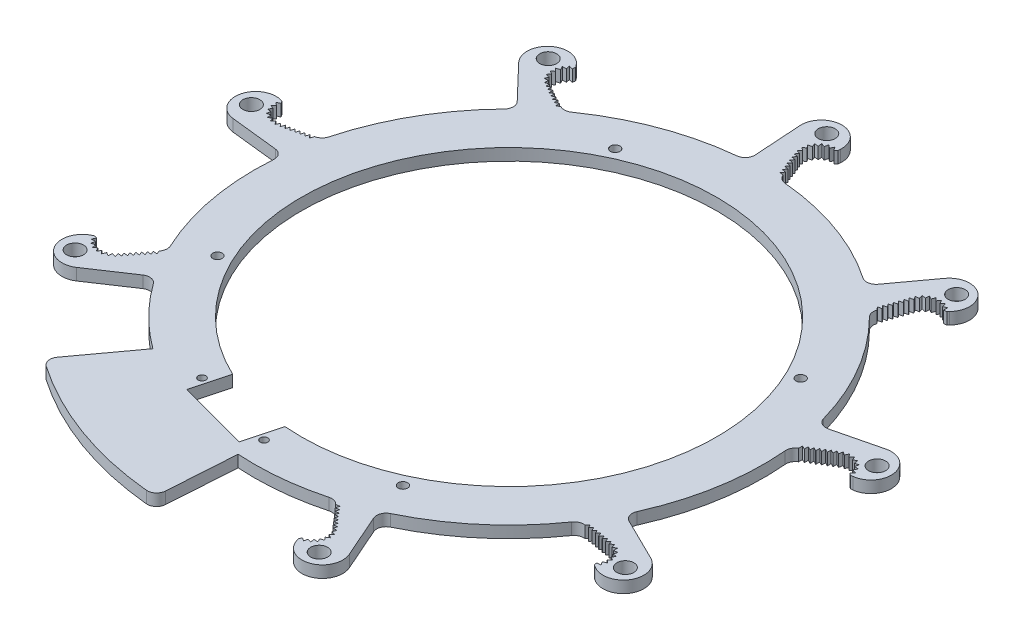
from build123d import *

# Parameters (mm, degrees)
SKETCH1_R           = 68.58
SKETCH1_R_2         = 55.88
BOSS_EXTRUDE1_DEPTH = 3.175
BOSS_EXTRUDE2_START = -3.175
BOSS_EXTRUDE2_DEPTH = 3.175
CIRPATTERN1_COUNT   = 9
SKETCH4_R           = 1.27
CUT_EXTRUDE1_DEPTH  = 126.801087163
CIRPATTERN14_COUNT  = 4
CUT_EXTRUDE3_DEPTH  = 126.801087163
CRVPATTERN1_DEPTH   = 3.175
CIRPATTERN15_COUNT  = 9
SKETCH3_R           = 2.286
CUT_EXTRUDE6_DEPTH  = 126.801087163
CIRPATTERN16_COUNT  = 9
BOSS_EXTRUDE3_START = -3.175
BOSS_EXTRUDE3_DEPTH = 3.175
SKETCH10_R          = 1.016
CUT_EXTRUDE7_DEPTH  = 126.801087163


# Read off the part's stored shape, not the designer's step: CrvPattern1
with BuildPart() as part:
    # Sketch1 → Boss-Extrude1 (new body)
    with BuildSketch(Plane(origin=(0, 0, 0), x_dir=(1, 0, 0), z_dir=(0, 1, 0))):
        with Locations(Location((0, 0, 0), (0, 0, 270))):
            Circle(SKETCH1_R)
        with Locations(Location((0, 0, 0), (0, 0, 270))):
            Circle(SKETCH1_R_2, mode=Mode.SUBTRACT)
    extrude(amount=BOSS_EXTRUDE1_DEPTH)

    # Sketch2 → Boss-Extrude2 (add)
    with BuildSketch(Plane(origin=(0, 3.175, 0), x_dir=(1, 0, 0), z_dir=(0, 1, 0)).offset(BOSS_EXTRUDE2_START)):
        with BuildLine():
            Line((-4.648503105, 70.922452149), (-5.403257241, 82.437775015))
            Line((-5.403257241, 82.437775015), (-5.486319215, 83.705055847))
            ThreePointArc((-5.486319215, 83.705055847), (0, 89.562739257), (5.486319215, 83.705055847))
            Line((5.486319215, 83.705055847), (5.403257241, 82.437775015))
            ThreePointArc((5.403257241, 82.437775015), (1.626784434, 81.258873226), (0.932471896, 77.364070743))
            Line((0.932471896, 77.364070743), (3.81, 69.933821868))
            ThreePointArc((3.81, 69.933821868), (4.653269667, 68.820093806), (5.957919454, 68.320711324))
            ThreePointArc((5.957919454, 68.320711324), (-0.486454802, 68.578274707), (-6.926526743, 68.22931648))
            ThreePointArc((-6.926526743, 68.22931648), (-5.243785443, 69.115963701), (-4.648503105, 70.922452149))
        make_face()
    boss_extrude2 = extrude(amount=BOSS_EXTRUDE2_DEPTH)

    # CirPattern1: Boss-Extrude2 ×9 about axis
    cirpattern1_axis = Axis((0, 0, 0), (0, 1, 0))
    for i in range(1, CIRPATTERN1_COUNT):
        add(boss_extrude2.rotate(cirpattern1_axis, i * 360 / CIRPATTERN1_COUNT))

    # Sketch4 → Cut-Extrude1 (cut, through all)
    with BuildSketch(Plane(origin=(0, 3.175, 0), x_dir=(1, 0, 0), z_dir=(0, 1, 0))):
        with Locations(Location((53.522006363, 24.957721447, 0), (0, 0, 270))):
            Circle(SKETCH4_R)
    cut_extrude1 = extrude(amount=-CUT_EXTRUDE1_DEPTH, mode=Mode.SUBTRACT)

    # CirPattern14: Cut-Extrude1 ×4 about axis
    cirpattern14_axis = Axis((0, 0, 0), (0, 1, 0))
    for i in range(1, CIRPATTERN14_COUNT):
        add(cut_extrude1.rotate(cirpattern14_axis, i * 360 / CIRPATTERN14_COUNT), mode=Mode.SUBTRACT)

    # Sketch8 → Cut-Extrude3 (cut, through all)
    with BuildSketch(Plane(origin=(0, 3.175, 0), x_dir=(1, 0, 0), z_dir=(0, 1, 0))):
        Polygon((3.498451264, 71.089959522), (3.95709435, 69.905667953), (2.780339552, 70.130899269), align=None)
    cut_extrude3 = extrude(amount=-CUT_EXTRUDE3_DEPTH, mode=Mode.SUBTRACT)

    # CrvPattern1 outline → CrvPattern1 (cut)
    with BuildSketch(Plane(origin=(0, 0, 0), x_dir=(1, 0, 0), z_dir=(0, 1, 0))):
        with BuildLine():
            Line((0.965870842, 77.246670917), (0.345476312, 76.418114962))
            Line((0.345476312, 76.418114962), (1.37513676, 76.22103756))
            Line((1.37513676, 76.22103756), (0.932471896, 77.364070743))
            ThreePointArc((0.932471896, 77.364070743), (1.626784434, 81.258873226), (5.403257241, 82.437775015))
            Line((5.403257241, 82.437775015), (5.449136611, 83.137758941))
            Line((5.449136611, 83.137758941), (4.852674168, 82.560680789))
            Line((4.852674168, 82.560680789), (4.242889668, 83.432740738))
            Line((4.242889668, 83.432740738), (3.726224495, 82.50248121))
            Line((3.726224495, 82.50248121), (2.88928111, 83.159635273))
            Line((2.88928111, 83.159635273), (2.665331301, 82.119360225))
            Line((2.665331301, 82.119360225), (1.673506022, 82.504857707))
            Line((1.673506022, 82.504857707), (1.761611498, 81.444403504))
            Line((1.761611498, 81.444403504), (0.700556651, 81.524953505))
            Line((0.700556651, 81.524953505), (1.093108774, 80.535899147))
            Line((1.093108774, 80.535899147), (0.05445523, 80.304545508))
            Line((0.05445523, 80.304545508), (0.717553875, 79.472304029))
            Line((0.717553875, 79.472304029), (-0.209002033, 78.949026052))
            Line((-0.209002033, 78.949026052), (0.667379075, 78.345468395))
            Line((0.667379075, 78.345468395), (-0.067063422, 77.575455466))
            Line((-0.067063422, 77.575455466), (0.965870842, 77.246670917))
        make_face()
        Polygon((3.40418946, 70.98169115), (3.00287676, 72.017946273), (2.374529012, 71.178768551), align=None)
        Polygon((2.99837892, 72.029560432), (2.59706622, 73.065815555), (1.968718472, 72.226637833), align=None)
        Polygon((2.59256838, 73.077429714), (2.19125568, 74.113684837), (1.562907932, 73.274507115), align=None)
        Polygon((2.18675784, 74.125298996), (1.78544514, 75.161554119), (1.157097392, 74.322376397), align=None)
        Polygon((1.7809473, 75.173168278), (1.3796346, 76.209423401), (0.751286852, 75.37024568), align=None)
    crvpattern1 = extrude(amount=CRVPATTERN1_DEPTH, mode=Mode.SUBTRACT)

    # CirPattern15: Cut-Extrude3, CrvPattern1 ×9 about axis, 1 skipped
    cirpattern15_axis = Axis((0, 0, 0), (0, -1, 0))
    add([cut_extrude3.rotate(cirpattern15_axis, i * 360 / CIRPATTERN15_COUNT) for i in range(1, CIRPATTERN15_COUNT) if i not in (5,)], mode=Mode.SUBTRACT)
    add([crvpattern1.rotate(cirpattern15_axis, i * 360 / CIRPATTERN15_COUNT) for i in range(1, CIRPATTERN15_COUNT) if i not in (5,)], mode=Mode.SUBTRACT)

    # Sketch3 → Cut-Extrude6 (cut, through all)
    with BuildSketch(Plane(origin=(0, 3.175, 0), x_dir=(1, 0, 0), z_dir=(0, 1, 0))):
        with Locations(Location((0, 85.498739257, 0), (0, 0, 270))):
            Circle(SKETCH3_R)
    cut_extrude6 = extrude(amount=-CUT_EXTRUDE6_DEPTH, mode=Mode.SUBTRACT)

    # CirPattern16: Cut-Extrude6 ×9 about axis, 1 skipped
    cirpattern16_axis = Axis((0, 0, 0), (0, -1, 0))
    add([cut_extrude6.rotate(cirpattern16_axis, i * 360 / CIRPATTERN16_COUNT) for i in range(1, CIRPATTERN16_COUNT) if i not in (5,)], mode=Mode.SUBTRACT)

    # Sketch9 → Boss-Extrude3 (add)
    with BuildSketch(Plane(origin=(0, 3.175, 0), x_dir=(1, 0, 0), z_dir=(0, 1, 0)).offset(BOSS_EXTRUDE3_START)):
        with BuildLine():
            ThreePointArc((-23.473361516, -80.533454986), (-26.266415504, -83.899198551), (-30.632261018, -84.161445141))
            ThreePointArc((-30.632261018, -84.161445141), (-19.707239561, -87.367665484), (-8.463727598, -89.161928974))
            ThreePointArc((-8.463727598, -89.161928974), (-6.577008759, -88.567209197), (-5.689134551, -86.799419905))
            Line((-5.689134551, -86.799419905), (-4.485346603, -68.433164956))
            ThreePointArc((-4.485346603, -68.433164956), (-10.700662367, -67.740034137), (-16.826994534, -66.483596887))
            ThreePointArc((-16.826994534, -66.483596887), (-18.711505325, -66.741241317), (-19.888743183, -68.235186631))
            Line((-19.888743183, -68.235186631), (-23.473361516, -80.533454986))
        make_face()
        with BuildLine():
            Line((-40.552015685, -55.305970961), (-51.435461734, -70.149118483))
            ThreePointArc((-51.435461734, -70.149118483), (-51.891623684, -72.074038187), (-50.828591706, -73.74237946))
            ThreePointArc((-50.828591706, -73.74237946), (-41.062231601, -79.595084014), (-30.632261018, -84.161445141))
            ThreePointArc((-30.632261018, -84.161445141), (-33.808123696, -81.154241171), (-33.78426888, -76.780591618))
            Line((-33.78426888, -76.780591618), (-33.272780584, -75.618146039))
            ThreePointArc((-33.272780584, -75.618146039), (-29.320848796, -75.801970499), (-27.336307524, -72.379522219))
            Line((-27.336307524, -72.379522219), (-27.499004664, -64.413199606))
            ThreePointArc((-27.499004664, -64.413199606), (-27.910501516, -63.078222352), (-28.965672425, -62.162739812))
            ThreePointArc((-28.965672425, -62.162739812), (-34.927511503, -59.019364112), (-40.552015685, -55.305970961))
        make_face()
    extrude(amount=BOSS_EXTRUDE3_DEPTH)

    # Sketch10 → Cut-Extrude7 (cut, through all)
    with BuildSketch(Plane(origin=(0, 3.175, 0), x_dir=(1, 0, 0), z_dir=(0, 1, 0))):
        with Locations(Location((-27.135809127, -55.503697087, 0), (0, 0, 270))):
            Circle(SKETCH10_R)
        with Locations(Location((-4.32221812, -61.630600823, 0), (0, 0, 270))):
            Circle(SKETCH10_R)
        with BuildLine():
            Line((-26.427891394, -59.967577796), (-23.889535462, -50.515982574))
            ThreePointArc((-23.889535462, -50.515982574), (-14.493750773, -53.967634639), (-4.632902193, -55.687616373))
            Line((-4.632902193, -55.687616373), (-7.171258126, -65.139211594))
            Line((-7.171258126, -65.139211594), (-7.237138811, -65.384519025))
            Line((-7.237138811, -65.384519025), (-26.49377208, -60.212885226))
            Line((-26.49377208, -60.212885226), (-26.427891394, -59.967577796))
        make_face()
    extrude(amount=-CUT_EXTRUDE7_DEPTH, mode=Mode.SUBTRACT)


solid = part.part
